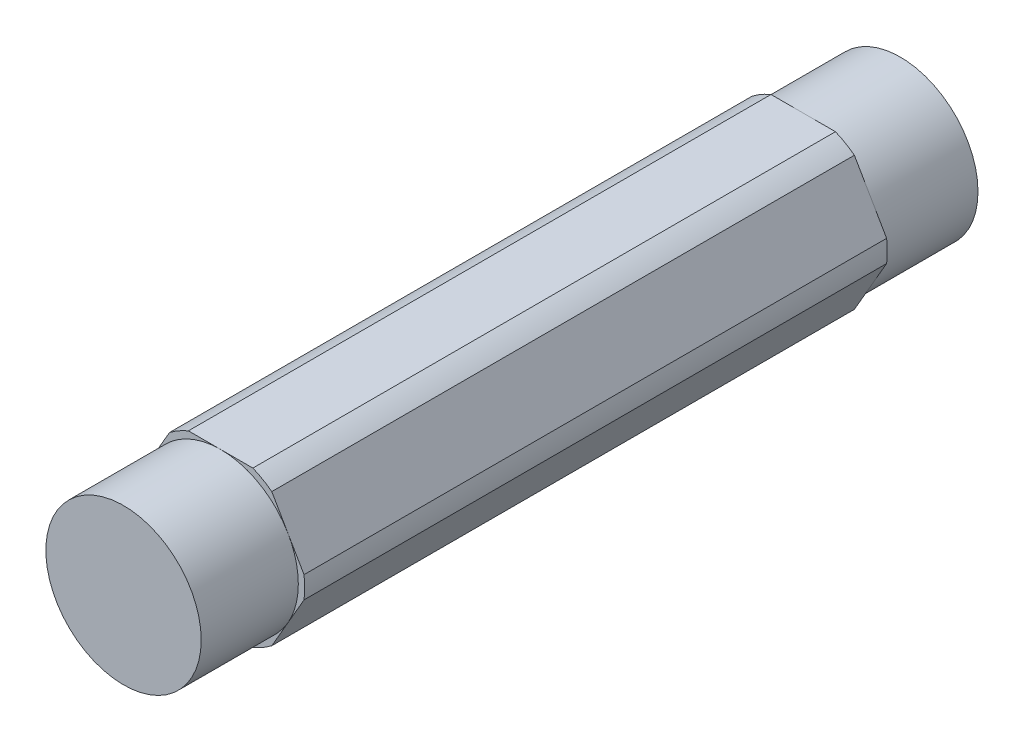
from build123d import *

# Parameters (mm, degrees)
BOSS_EXTRUDE1_DEPTH = 31.75
CUT_EXTRUDE2_DEPTH  = 7.9375


with BuildPart() as part:
    # Sketch1 → Boss-Extrude1 (new, symmetric)
    with BuildSketch(Plane.XY):
        with BuildLine():
            ThreePointArc((-2.634980936, 6.35), (-3.437499983, 5.953924622), (-4.181770846, 5.456960429))
            Line((-4.181770846, 5.456960429), (-6.816751782, 0.893039571))
            ThreePointArc((-6.816751782, 0.893039571), (-6.874999966, 0), (-6.816751782, -0.893039571))
            Line((-6.816751782, -0.893039571), (-4.181770846, -5.456960429))
            ThreePointArc((-4.181770846, -5.456960429), (-3.437499983, -5.953924622), (-2.634980936, -6.35))
            Line((-2.634980936, -6.35), (2.634980936, -6.35))
            ThreePointArc((2.634980936, -6.35), (3.437499983, -5.953924622), (4.181770846, -5.456960429))
            Line((4.181770846, -5.456960429), (6.816751782, -0.893039571))
            ThreePointArc((6.816751782, -0.893039571), (6.860422465, -0.447468582), (6.874999966, 0))
            ThreePointArc((6.874999966, 0), (6.860422465, 0.447468582), (6.816751782, 0.893039571))
            Line((6.816751782, 0.893039571), (4.181770846, 5.456960429))
            ThreePointArc((4.181770846, 5.456960429), (3.437499983, 5.953924622), (2.634980936, 6.35))
            Line((2.634980936, 6.35), (-2.634980936, 6.35))
        make_face()
    extrude(amount=BOSS_EXTRUDE1_DEPTH, both=True)

    # Sketch2 → Cut-Extrude2 (cut)
    with BuildSketch(Plane.XY.offset(31.75)):
        with BuildLine():
            ThreePointArc((5.499261354, 3.174999932), (6.35, -2.7e-08), (5.499261327, -3.174999977))
            Line((5.499261327, -3.174999977), (6.816751782, -0.893039571))
            ThreePointArc((6.816751782, -0.893039571), (6.874999966, 0), (6.816751782, 0.893039571))
            Line((6.816751782, 0.893039571), (5.499261354, 3.174999932))
        make_face()
        with BuildLine():
            ThreePointArc((1.8e-08, 6.35), (3.175000042, 5.49926129), (5.499261354, 3.174999932))
            Line((5.499261354, 3.174999932), (4.181770846, 5.456960429))
            ThreePointArc((4.181770846, 5.456960429), (3.437499983, 5.953924622), (2.634980936, 6.35))
            Line((2.634980936, 6.35), (1.8e-08, 6.35))
        make_face()
        with BuildLine():
            Line((4.181770846, -5.456960429), (5.499261327, -3.174999977))
            ThreePointArc((5.499261327, -3.174999977), (3.175000011, -5.499261308), (0, -6.35))
            Line((0, -6.35), (2.634980936, -6.35))
            ThreePointArc((2.634980936, -6.35), (3.437499983, -5.953924622), (4.181770846, -5.456960429))
        make_face()
        with BuildLine():
            ThreePointArc((-5.499261332, 3.174999968), (-3.175000008, 5.499261309), (1.8e-08, 6.35))
            Line((1.8e-08, 6.35), (-2.634980936, 6.35))
            ThreePointArc((-2.634980936, 6.35), (-3.437499983, 5.953924622), (-4.181770846, 5.456960429))
            Line((-4.181770846, 5.456960429), (-5.499261332, 3.174999968))
        make_face()
        with BuildLine():
            Line((-2.634980936, -6.35), (0, -6.35))
            ThreePointArc((0, -6.35), (-3.174999938, -5.49926135), (-5.499261242, -3.175000124))
            Line((-5.499261242, -3.175000124), (-4.181770846, -5.456960429))
            ThreePointArc((-4.181770846, -5.456960429), (-3.437499983, -5.953924622), (-2.634980936, -6.35))
        make_face()
        with BuildLine():
            ThreePointArc((-5.499261242, -3.175000124), (-6.35, -9e-08), (-5.499261332, 3.174999968))
            Line((-5.499261332, 3.174999968), (-6.816751782, 0.893039571))
            ThreePointArc((-6.816751782, 0.893039571), (-6.874999966, 0), (-6.816751782, -0.893039571))
            Line((-6.816751782, -0.893039571), (-5.499261242, -3.175000124))
        make_face()
    cut_extrude2 = extrude(amount=-CUT_EXTRUDE2_DEPTH, mode=Mode.SUBTRACT)

    # Mirror1: Cut-Extrude2 across plane
    add(cut_extrude2.mirror(Plane.XY), mode=Mode.SUBTRACT)


solid = part.part
